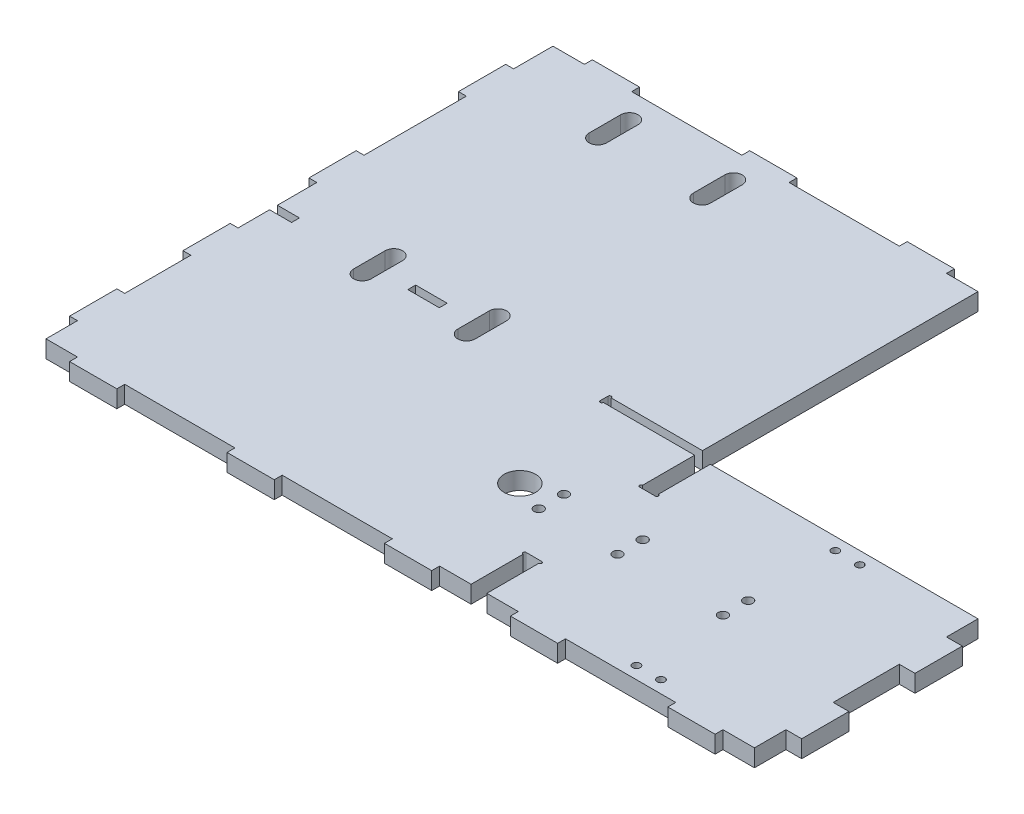
from build123d import *

# Parameters (mm, degrees)
BODY_DELETE_KEEP_START         = -69.85
BODY_DELETE_KEEP_1_OUTLINE_W   = 12.7
BODY_DELETE_KEEP_1_OUTLINE_H   = 3.175
BODY_DELETE_KEEP_1_OUTLINE_R   = 1.905
BODY_DELETE_KEEP_1_OUTLINE_R_2 = 6.35
BODY_DELETE_KEEP_1_OUTLINE_R_3 = 1.5367
BODY_DELETE_KEEP_1_DEPTH       = 6.985
SKETCH1_R                      = 0.635
CUT_EXTRUDE1_DEPTH             = 257.935529511


# Read off the part's stored shape, not the designer's step: Body-Delete/Keep 1
with BuildPart() as part:
    # Body-Delete/Keep 1 outline → Body-Delete/Keep 1 (new body)
    with BuildSketch(Plane(origin=(0, 0, 0), x_dir=(1, 0, 0), z_dir=(0, 1, 0)).offset(BODY_DELETE_KEEP_START)):
        Polygon((90.075, -13.335), (90.075, 13.335), (96.425, 13.335), (96.425, 32.385), (90.075, 32.385), (90.075, 45.085), (-17.875, 45.085), (-17.875, 22.86), (-24.225, 22.86), (-24.225, 45.085), (-62.325, 45.085), (-62.325, 48.26), (-24.225, 48.26), (-24.225, 159.385), (-36.925, 159.385), (-36.925, 162.56), (-55.975, 162.56), (-55.975, 159.385), (-100.425, 159.385), (-100.425, 162.56), (-119.475, 162.56), (-119.475, 159.385), (-163.925, 159.385), (-163.925, 162.56), (-182.975, 162.56), (-182.975, 159.385), (-195.675, 159.385), (-195.675, 143.51), (-198.85, 143.51), (-198.85, 124.46), (-195.675, 124.46), (-195.675, 83.185), (-198.85, 83.185), (-198.85, 64.135), (-195.675, 64.135), (-195.675, 48.26), (-186.785, 48.26), (-186.785, 45.085), (-195.675, 45.085), (-195.675, 32.385), (-198.85, 32.385), (-198.85, 13.335), (-195.675, 13.335), (-195.675, -13.335), (-198.85, -13.335), (-198.85, -32.385), (-195.675, -32.385), (-195.675, -45.085), (-182.975, -45.085), (-182.975, -48.26), (-163.925, -48.26), (-163.925, -45.085), (-119.475, -45.085), (-119.475, -48.26), (-100.425, -48.26), (-100.425, -45.085), (-55.975, -45.085), (-55.975, -48.26), (-36.925, -48.26), (-36.925, -45.085), (-24.225, -45.085), (-24.225, -22.86), (-17.875, -22.86), (-17.875, -45.085), (-5.175, -45.085), (-5.175, -48.26), (13.875, -48.26), (13.875, -45.085), (58.325, -45.085), (58.325, -48.26), (77.375, -48.26), (77.375, -45.085), (90.075, -45.085), (90.075, -32.385), (96.425, -32.385), (96.425, -13.335), align=None)
        with BuildLine():
            Line((-151.0668, 54.1), (-151.0668, 41.4))
            ThreePointArc((-151.0668, 41.4), (-154.5593, 37.9075), (-158.0518, 41.4))
            Line((-158.0518, 41.4), (-158.0518, 54.1))
            ThreePointArc((-158.0518, 54.1), (-154.5593, 57.5925), (-151.0668, 54.1))
        make_face(mode=Mode.SUBTRACT)
        with Locations((-133.5593, 46.6725)):
            Rectangle(BODY_DELETE_KEEP_1_OUTLINE_W, BODY_DELETE_KEEP_1_OUTLINE_H, mode=Mode.SUBTRACT)
        with BuildLine():
            Line((-109.0668, 54.1), (-109.0668, 41.4))
            ThreePointArc((-109.0668, 41.4), (-112.5593, 37.9075), (-116.0518, 41.4))
            Line((-116.0518, 41.4), (-116.0518, 54.1))
            ThreePointArc((-116.0518, 54.1), (-112.5593, 57.5925), (-109.0668, 54.1))
        make_face(mode=Mode.SUBTRACT)
        with Locations((-36.925, -5.08)):
            Circle(BODY_DELETE_KEEP_1_OUTLINE_R, mode=Mode.SUBTRACT)
        with Locations((-49.625, 0)):
            Circle(BODY_DELETE_KEEP_1_OUTLINE_R_2, mode=Mode.SUBTRACT)
        with Locations((-5.175, -5.08)):
            Circle(BODY_DELETE_KEEP_1_OUTLINE_R, mode=Mode.SUBTRACT)
        with Locations((37.5, -40.11)):
            Circle(BODY_DELETE_KEEP_1_OUTLINE_R_3, mode=Mode.SUBTRACT)
        with Locations((47.4, -40.11)):
            Circle(BODY_DELETE_KEEP_1_OUTLINE_R_3, mode=Mode.SUBTRACT)
        with Locations((37.37, -5.08)):
            Circle(BODY_DELETE_KEEP_1_OUTLINE_R, mode=Mode.SUBTRACT)
        with Locations((-36.925, 5.08)):
            Circle(BODY_DELETE_KEEP_1_OUTLINE_R, mode=Mode.SUBTRACT)
        with Locations((-5.175, 5.08)):
            Circle(BODY_DELETE_KEEP_1_OUTLINE_R, mode=Mode.SUBTRACT)
        with Locations((37.37, 5.08)):
            Circle(BODY_DELETE_KEEP_1_OUTLINE_R, mode=Mode.SUBTRACT)
        with Locations((37.5, 40.11)):
            Circle(BODY_DELETE_KEEP_1_OUTLINE_R_3, mode=Mode.SUBTRACT)
        with Locations((47.4, 40.11)):
            Circle(BODY_DELETE_KEEP_1_OUTLINE_R_3, mode=Mode.SUBTRACT)
        with BuildLine():
            Line((-158.0518, 136.4), (-158.0518, 149.1))
            ThreePointArc((-158.0518, 149.1), (-154.5593, 152.5925), (-151.0668, 149.1))
            Line((-151.0668, 149.1), (-151.0668, 136.4))
            ThreePointArc((-151.0668, 136.4), (-154.5593, 132.9075), (-158.0518, 136.4))
        make_face(mode=Mode.SUBTRACT)
        with BuildLine():
            Line((-116.0518, 136.4), (-116.0518, 149.1))
            ThreePointArc((-116.0518, 149.1), (-112.5593, 152.5925), (-109.0668, 149.1))
            Line((-109.0668, 149.1), (-109.0668, 136.4))
            ThreePointArc((-109.0668, 136.4), (-112.5593, 132.9075), (-116.0518, 136.4))
        make_face(mode=Mode.SUBTRACT)
    extrude(amount=BODY_DELETE_KEEP_1_DEPTH)

    # Sketch1 → Cut-Extrude1 (cut, through all)
    with BuildSketch(Plane(origin=(0, -62.865, 0), x_dir=(1, 0, 0), z_dir=(0, 1, 0))):
        with Locations((-61.69, 48.26)):
            Circle(SKETCH1_R)
        with Locations((-61.69, 45.085)):
            Circle(SKETCH1_R)
        with Locations((-17.875, 23.495)):
            Circle(SKETCH1_R)
        with Locations((-24.225, 23.495)):
            Circle(SKETCH1_R)
        with Locations((-17.875, -23.495)):
            Circle(SKETCH1_R)
        with Locations((-24.225, -23.495)):
            Circle(SKETCH1_R)
    extrude(amount=-CUT_EXTRUDE1_DEPTH, mode=Mode.SUBTRACT)


solid = part.part
